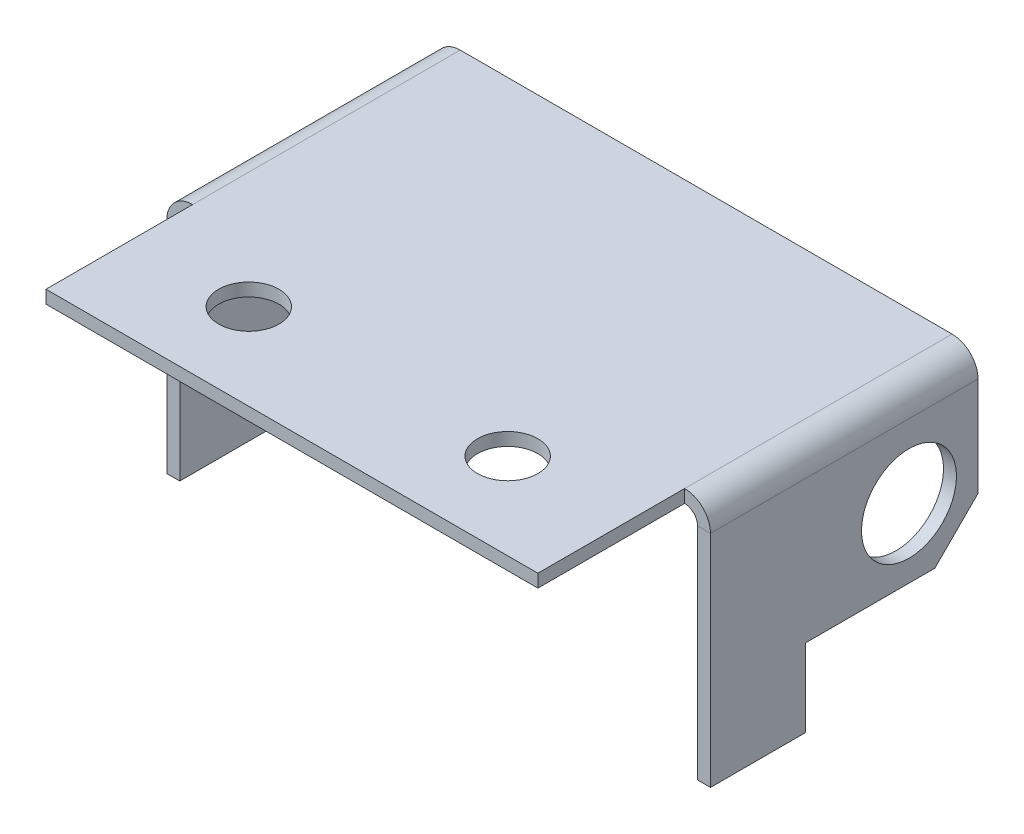
from build123d import *

# Parameters (mm, degrees)
SM_BASE_FLANGE_1_DEPTH   = 15.5
OTHER_START              = -23.68807717
OTHER_1_OUTLINE_W        = 1.5
OTHER_1_OUTLINE_H        = 10
OTHER_1_DEPTH            = 3.535533906
SKETCH_6_R               = 5.5
CUT_EXTRUDE_752_DEPTH    = 68.329414077
SKETCH_8_W               = 57
SKETCH_8_H               = 17
SM_BASE_FLANGE_1_2_DEPTH = 1.5
SKETCH_7_R               = 3.5
CUT_EXTRUDE_2_DEPTH      = 10
SKETCH_9_W               = 11
SKETCH_9_H               = 9
SM_BASE_FLANGE_2_DEPTH   = 1.5
SKETCH_12_W              = 11
SKETCH_12_H              = 9
SM_BASE_FLANGE_3_DEPTH   = 1.5


# Read off the part's stored shape, not the designer's step: Затупленный угол1
# Sheet-metal steps are written as plain solids
with BuildPart() as part:
    # Sketch 1 → Sm Base Flange 1 (new, symmetric)
    with BuildSketch(Plane.XY):
        with BuildLine():
            Line((-30, -18), (-30, -1.5))
            ThreePointArc((-30, -1.5), (-29.560660172, -0.439339828), (-28.5, 0))
            Line((-28.5, 0), (28.5, 0))
            ThreePointArc((28.5, 0), (29.560660172, -0.439339828), (30, -1.5))
            Line((30, -1.5), (30, -18))
            Line((30, -18), (31.5, -18))
            Line((31.5, -18), (31.5, -1.5))
            ThreePointArc((31.5, -1.5), (30.621320344, 0.621320344), (28.5, 1.5))
            Line((28.5, 1.5), (-28.5, 1.5))
            ThreePointArc((-28.5, 1.5), (-30.621320344, 0.621320344), (-31.5, -1.5))
            Line((-31.5, -1.5), (-31.5, -18))
            Line((-31.5, -18), (-30, -18))
        make_face()
    extrude(amount=SM_BASE_FLANGE_1_DEPTH, both=True)

    # Other 1 outline → Other 1 (cut)
    with BuildSketch(Plane(origin=(0, 0, 0), x_dir=(1, 0, 0), z_dir=(0, 0.7071067811865476, 0.7071067811865476)).offset(OTHER_START)):
        with Locations((-30.75, -2)):
            Rectangle(OTHER_1_OUTLINE_W, OTHER_1_OUTLINE_H)
        with Locations((30.75, -2)):
            Rectangle(OTHER_1_OUTLINE_W, OTHER_1_OUTLINE_H)
    extrude(amount=OTHER_1_DEPTH, mode=Mode.SUBTRACT)

    # Эскиз6 → Cut-Extrude 752 (cut, through all)
    with BuildSketch(Plane.ZY.offset(31.5)):
        with Locations((-7.5, -10)):
            Circle(SKETCH_6_R)
    extrude(amount=-CUT_EXTRUDE_752_DEPTH, mode=Mode.SUBTRACT)

    # Эскиз8 → Sm Base Flange 1 2 (add)
    with BuildSketch(Plane(origin=(0, 1.5, 0), x_dir=(1, 0, 0), z_dir=(0, 1, 0))):
        with Locations((0, -24)):
            Rectangle(SKETCH_8_W, SKETCH_8_H)
    extrude(amount=-SM_BASE_FLANGE_1_2_DEPTH)

    # Эскиз7 → Вырез-Вытянуть2 (cut)
    with BuildSketch(Plane(origin=(0, 1.5, 0), x_dir=(1, 0, 0), z_dir=(0, 1, 0))):
        with Locations(Location((-15, -22.5, 0), (0, 0, 270))):
            Circle(SKETCH_7_R)
        with Locations(Location((15, -22.5, 0), (0, 0, 90))):
            Circle(SKETCH_7_R)
    extrude(amount=-CUT_EXTRUDE_2_DEPTH, mode=Mode.SUBTRACT)

    # Эскиз9 → Выступ2 (add)
    with BuildSketch(Plane(origin=(31.5, 0, 0), x_dir=(0, 0, -1), z_dir=(1, 0, 0))):
        with Locations((-10, -22.5)):
            Rectangle(SKETCH_9_W, SKETCH_9_H)
    extrude(amount=-SM_BASE_FLANGE_2_DEPTH)

    # Эскиз12 → Выступ3 (add)
    with BuildSketch(Plane.ZY.offset(31.5)):
        with Locations((10, -22.5)):
            Rectangle(SKETCH_12_W, SKETCH_12_H)
    extrude(amount=-SM_BASE_FLANGE_3_DEPTH)


solid = part.part
